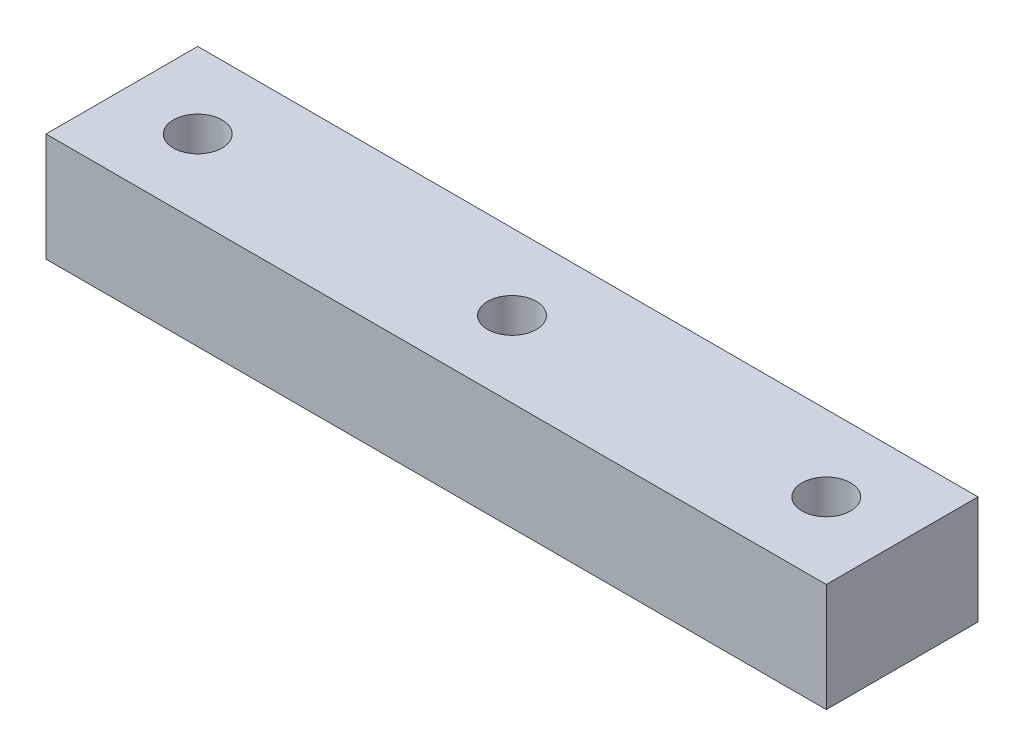
from build123d import *

# Parameters (mm, degrees)
SKETCH1_W           = 72
SKETCH1_H           = 14
SKETCH1_R           = 2.25
BOSS_EXTRUDE1_DEPTH = 10


with BuildPart() as part:
    # Sketch1 → Boss-Extrude1 (new body)
    with BuildSketch(Plane(origin=(0, 0, 0), x_dir=(1, 0, 0), z_dir=(0, 1, 0))):
        Rectangle(SKETCH1_W, SKETCH1_H)
        Circle(SKETCH1_R, mode=Mode.SUBTRACT)
        with Locations((-29, 0)):
            Circle(SKETCH1_R, mode=Mode.SUBTRACT)
        with Locations((29, 0)):
            Circle(SKETCH1_R, mode=Mode.SUBTRACT)
    extrude(amount=BOSS_EXTRUDE1_DEPTH)


solid = part.part
